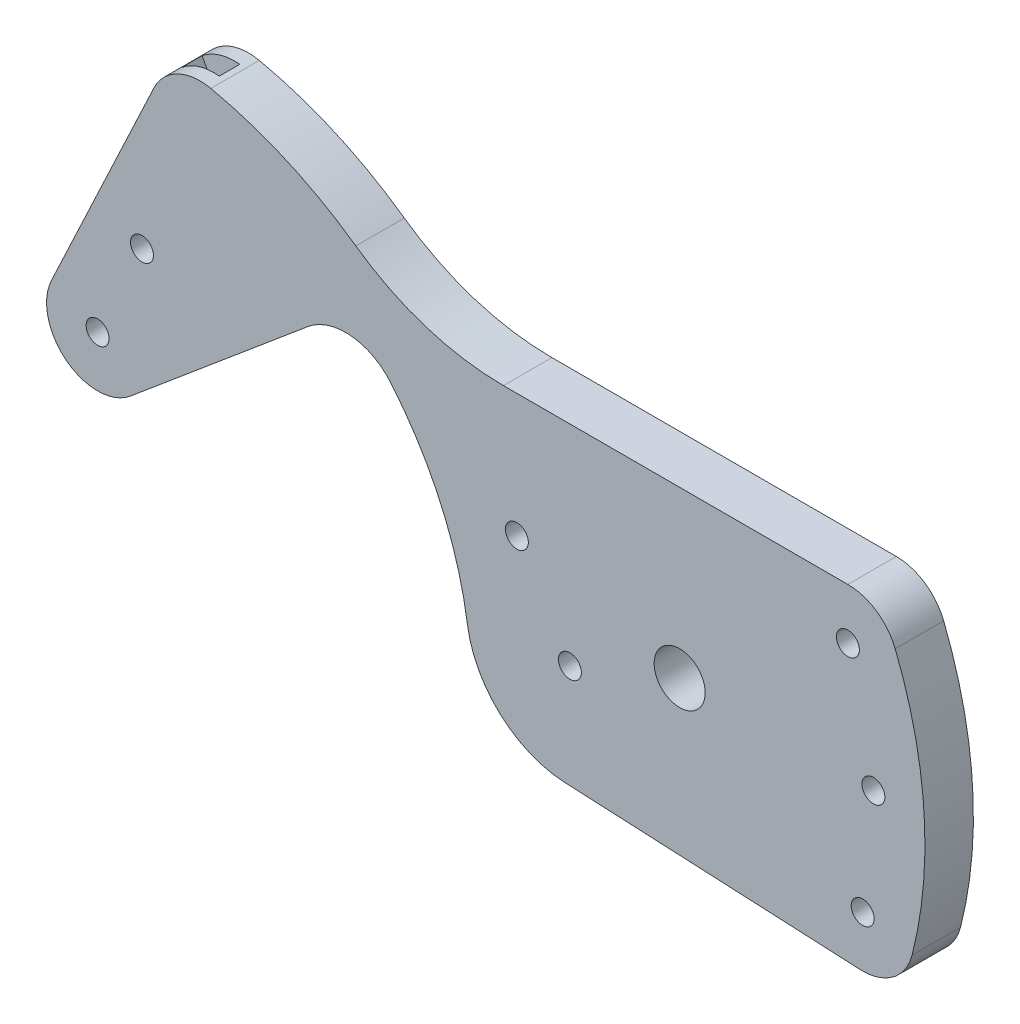
from build123d import *

# Parameters (mm, degrees)
SKETCH1_R           = 2.25
SKETCH1_R_2         = 5
BOSS_EXTRUDE1_DEPTH = 4.75
CUT_EXTRUDE1_DEPTH  = 2


with BuildPart() as part:
    # Sketch1 → Boss-Extrude1 (new, symmetric)
    with BuildSketch(Plane.XY):
        with BuildLine():
            Line((-22.500230832, -28.983987123), (35.398437983, -31.788291003))
            ThreePointArc((35.398437983, -31.788291003), (41.825152283, -29.842482755), (45.572267137, -24.270413418))
            ThreePointArc((45.572267137, -24.270413418), (47.922199842, 1.185089324), (42.266415188, 26.115330067))
            ThreePointArc((42.266415188, 26.115330067), (38.587871094, 30.681102), (32.982217728, 32.4))
            Line((32.982217728, 32.4), (-34.53815208, 32.4))
            ThreePointArc((-34.53815208, 32.4), (-49.730929753, 34.764094355), (-63.487021029, 41.632819737))
            ThreePointArc((-63.487021029, 41.632819737), (-77.067258547, 49.344582351), (-91.918742124, 54.174444589))
            ThreePointArc((-91.918742124, 54.174444589), (-98.466295495, 53.366674665), (-103.085929893, 48.656905518))
            Line((-103.085929893, 48.656905518), (-123.167077545, 5.955614534))
            ThreePointArc((-123.167077545, 5.955614534), (-120.218280198, -6.2236308), (-107.689906175, -5.960444431))
            Line((-107.689906175, -5.960444431), (-72.864818345, 23.261273923))
            ThreePointArc((-72.864818345, 23.261273923), (-64.470178387, 25.908093735), (-56.662687309, 21.843771132))
            ThreePointArc((-56.662687309, 21.843771132), (-46.809939593, 6.135423294), (-41.608278072, -11.662653759))
            ThreePointArc((-41.608278072, -11.662653759), (-35.156858245, -23.745961099), (-22.500230832, -28.983987123))
        make_face()
        with Locations((35.882217728, -21.8)):
            Circle(SKETCH1_R, mode=Mode.SUBTRACT)
        with Locations((-21.517782272, -8.7)):
            Circle(SKETCH1_R, mode=Mode.SUBTRACT)
        Circle(SKETCH1_R_2, mode=Mode.SUBTRACT)
        with Locations((-31.917782272, 8.2)):
            Circle(SKETCH1_R, mode=Mode.SUBTRACT)
        with Locations((37.982217728, -0.1)):
            Circle(SKETCH1_R, mode=Mode.SUBTRACT)
        with Locations((32.982217728, 22.4)):
            Circle(SKETCH1_R, mode=Mode.SUBTRACT)
        with Locations((-105.417782272, 20.2)):
            Circle(SKETCH1_R, mode=Mode.SUBTRACT)
        with Locations((-114.117782272, 1.7)):
            Circle(SKETCH1_R, mode=Mode.SUBTRACT)
    extrude(amount=BOSS_EXTRUDE1_DEPTH, both=True)

    # Sketch2 → Cut-Extrude1 (cut, symmetric)
    with BuildSketch(Plane.XY):
        with BuildLine():
            Line((-78.227129447, 18.761760655), (-92.084556702, 44.987885053))
            Line((-92.084556702, 44.987885053), (-93.002217677, 54.347646176))
            ThreePointArc((-93.002217677, 54.347646176), (-96.914482214, 53.978242129), (-100.382341665, 52.129939126))
            Line((-100.382341665, 52.129939126), (-95.988712538, 43.814696915))
            Line((-95.988712538, 43.814696915), (-92.369017313, 6.895307763))
            Line((-92.369017313, 6.895307763), (-78.227129447, 18.761760655))
        make_face()
    extrude(amount=CUT_EXTRUDE1_DEPTH, both=True, mode=Mode.SUBTRACT)


solid = part.part
